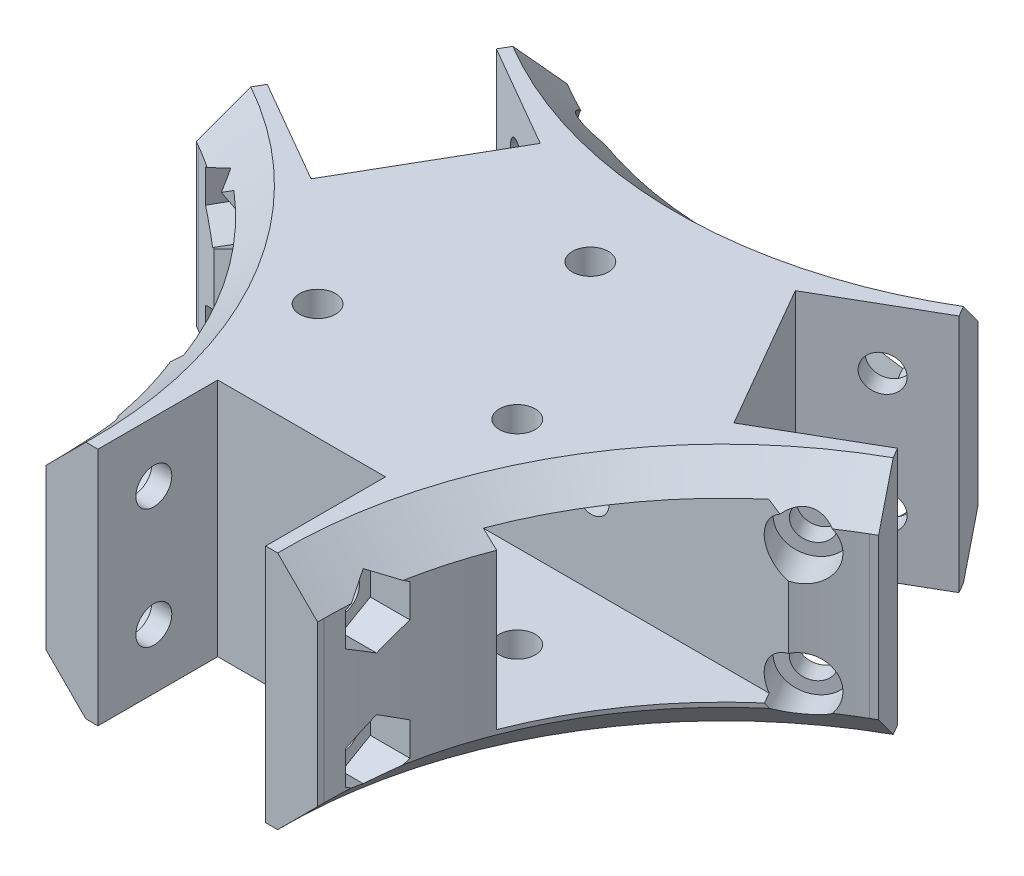
from build123d import *

# Parameters (mm, degrees)
BOSS_EXTRUDE1_DEPTH     = 30
FILLET1_R               = 50
SKETCH2_W               = 21
SKETCH2_H               = 21
CUT_EXTRUDE1_DEPTH      = 40
CHAMFER1_SIZE           = 5
CUT_EXTRUDE2_DEPTH      = 20
CUT_EXTRUDE2_DEPTH_BACK = 80
SKETCH3_R               = 2.25
SKETCH3_3_R             = 4
SKETCH3_3_R_2           = 2.25
CUT_EXTRUDE3_DEPTH      = 80
SKETCH4_R               = 2.25
CUT_EXTRUDE4_DEPTH      = 80
SKETCH5_R               = 3.75
CUT_EXTRUDE5_DEPTH      = 10
CUT_EXTRUDE6_DEPTH      = 10
CIRPATTERN1_COUNT       = 3
SKETCH7_R               = 2.25
CUT_EXTRUDE7_DEPTH      = 43
CUT_EXTRUDE8_DEPTH      = 43
CUT_EXTRUDE8_DEPTH_BACK = 43
SKETCH8_R               = 2.25
SKETCH8_6_R             = 2.25
CUT_EXTRUDE10_DEPTH     = 43


with BuildPart() as part:
    # Sketch1 → Boss-Extrude1 (new body)
    with BuildSketch(Plane(origin=(0, 608.934991197, 0), x_dir=(1, 0, 0), z_dir=(0, 1, 0))):
        Polygon((-26.467622393, 3.15673326), (-39.458003449, 10.65673326), (-42.708003449, 5.027568136), (-17, -9.814954576), (-17, -39.5), (-10.5, -39.5), (-10.5, -24.5), (10.5, -24.5), (10.5, -39.5), (17, -39.5), (17, -9.814954576), (42.708003449, 5.027568136), (39.458003449, 10.65673326), (26.467622393, 3.15673326), (15.967622393, 21.34326674), (28.958003449, 28.84326674), (25.708003449, 34.472431864), (0, 19.629909152), (-25.708003449, 34.472431864), (-28.958003449, 28.84326674), (-15.967622393, 21.34326674), align=None)
    extrude(amount=-BOSS_EXTRUDE1_DEPTH)

    # Fillet1
    fillet1_edges = [part.edges().sort_by_distance(p)[0] for p in [
        (17, 593.934991197, 9.814954576),
        (-17, 593.934991197, 9.814954576),
        (0, 593.934991197, -19.629909152),
    ]]
    fillet(fillet1_edges, radius=FILLET1_R)

    # Sketch2 → Cut-Extrude1 (cut, symmetric)
    with BuildSketch(Plane(origin=(0, 0, 0), x_dir=(0, 0, -1), z_dir=(1, 0, 0))):
        with Locations((-10, 595)):
            Rectangle(SKETCH2_W, SKETCH2_H)
    extrude(amount=CUT_EXTRUDE1_DEPTH, both=True, mode=Mode.SUBTRACT)

    # Chamfer1
    # the kernel refuses this chamfer: 5 mm, written as the material it takes off along each edge
    with BuildSketch(Plane(origin=(67, 608.934991197, 38.682468036), x_dir=(-0.9671024008469528, 0, 0.25438739409817457), z_dir=(0.25438739409817457, 0, 0.9671024008469528))) as chamfer1_piece_1:
        Polygon((50 + CHAMFER1_SIZE, 0), (50, CHAMFER1_SIZE), (50, 0), align=None)
    revolve(axis=Axis((67, 608.934991197, 38.682468036), (0, -1, 0)), revolution_arc=89.474576832, mode=Mode.SUBTRACT)
    with BuildSketch(Plane(origin=(-67, 608.934991197, 38.682468036), x_dir=(0.2632452547319335, 0, -0.9647289442434697), z_dir=(-0.9647289442434697, 0, -0.2632452547319335))) as chamfer1_piece_2:
        Polygon((50 + CHAMFER1_SIZE, 0), (50, CHAMFER1_SIZE), (50, 0), align=None)
    revolve(axis=Axis((-67, 608.934991197, 38.682468036), (0, -1, 0)), revolution_arc=89.474576832, mode=Mode.SUBTRACT)
    with BuildSketch(Plane(origin=(0, 608.934991197, -77.364936071), x_dir=(0.7038571461150196, 0, 0.7103415501452945), z_dir=(0.7103415501452945, 0, -0.7038571461150196))) as chamfer1_piece_3:
        Polygon((50 + CHAMFER1_SIZE, 0), (50, CHAMFER1_SIZE), (50, 0), align=None)
    revolve(axis=Axis((0, 608.934991197, -77.364936071), (0, -1, 0)), revolution_arc=89.474576832, mode=Mode.SUBTRACT)
    with BuildSketch(Plane(origin=(-67, 578.934991197, 38.682468036), x_dir=(0.2632452547319335, 0, -0.9647289442434697), z_dir=(-0.9647289442434697, 0, -0.2632452547319335))) as chamfer1_piece_4:
        Polygon((50, -CHAMFER1_SIZE), (50 + CHAMFER1_SIZE, 0), (50, 0), align=None)
    revolve(axis=Axis((-67, 578.934991197, 38.682468036), (0, -1, 0)), revolution_arc=89.474576832, mode=Mode.SUBTRACT)
    with BuildSketch(Plane(origin=(67, 578.934991197, 38.682468036), x_dir=(-0.9671024008469528, 0, 0.25438739409817457), z_dir=(0.25438739409817457, 0, 0.9671024008469528))) as chamfer1_piece_5:
        Polygon((50 + CHAMFER1_SIZE, 0), (50, -CHAMFER1_SIZE), (50, 0), align=None)
    revolve(axis=Axis((67, 578.934991197, 38.682468036), (0, -1, 0)), revolution_arc=89.474576832, mode=Mode.SUBTRACT)
    with BuildSketch(Plane(origin=(0, 578.934991197, -77.364936071), x_dir=(0.7038571461150196, 0, 0.7103415501452945), z_dir=(0.7103415501452945, 0, -0.7038571461150196))) as chamfer1_piece_6:
        Polygon((50 + CHAMFER1_SIZE, 0), (50, -CHAMFER1_SIZE), (50, 0), align=None)
    revolve(axis=Axis((0, 578.934991197, -77.364936071), (0, -1, 0)), revolution_arc=89.474576832, mode=Mode.SUBTRACT)

    # Sketch3 → Cut-Extrude2 (cut, two sides: drawn at the far end of the back side and taken through both)
    with BuildSketch(Plane.XY.offset(-10.5).offset(-CUT_EXTRUDE2_DEPTH_BACK)):
        with Locations(Location((-11.25, 595, 0), (0, 0, 180))):
            Circle(SKETCH3_R)
        with Locations(Location((11.25, 595, 0), (0, 0, 180))):
            Circle(SKETCH3_R)
    extrude(amount=CUT_EXTRUDE2_DEPTH + CUT_EXTRUDE2_DEPTH_BACK, mode=Mode.SUBTRACT)

    # Sketch3<3> → Cut-Extrude3 (cut)
    # profile 1 of 2: a face of its own
    with BuildSketch(Plane.XY.offset(-10.5)):
        with Locations((11.25, 595)):
            Circle(SKETCH3_3_R)
        with Locations(Location((11.25, 595, 0), (0, 0, 180))):
            Circle(SKETCH3_3_R_2, mode=Mode.SUBTRACT)
    # profile 2 of 2: a face of its own
    with BuildSketch(Plane.XY.offset(-10.5)):
        with Locations((-11.25, 595)):
            Circle(SKETCH3_3_R)
        with Locations(Location((-11.25, 595, 0), (0, 0, 180))):
            Circle(SKETCH3_3_R_2, mode=Mode.SUBTRACT)
    extrude(amount=-CUT_EXTRUDE3_DEPTH, mode=Mode.SUBTRACT)

    # Sketch4 → Cut-Extrude4 (cut, symmetric)
    with BuildSketch(Plane(origin=(0, 0, 0), x_dir=(0, 0, -1), z_dir=(1, 0, 0))):
        with Locations(Location((-32.5, 601.434991197, 0), (0, 0, 180))):
            Circle(SKETCH4_R)
        with Locations(Location((-32.5, 586.434991197, 0), (0, 0, 180))):
            Circle(SKETCH4_R)
    cut_extrude4 = extrude(amount=CUT_EXTRUDE4_DEPTH, both=True, mode=Mode.SUBTRACT)

    # Sketch5 → Cut-Extrude5 (cut)
    with BuildSketch(Plane(origin=(-13, 0, 0), x_dir=(0, 0, -1), z_dir=(1, 0, 0))):
        with Locations((-32.5, 601.434991197)):
            Circle(SKETCH5_R)
        with Locations((-32.5, 586.434991197)):
            Circle(SKETCH5_R)
    cut_extrude5 = extrude(amount=-CUT_EXTRUDE5_DEPTH, mode=Mode.SUBTRACT)

    # Sketch6 → Cut-Extrude6 (cut)
    with BuildSketch(Plane.ZY.offset(-13)):
        Polygon((32.5, 605.591913135), (28.9, 603.513452166), (28.9, 599.356530228), (32.5, 597.278069259), (36.1, 599.356530228), (36.1, 603.513452166), align=None)
        Polygon((32.5, 590.591913135), (28.9, 588.513452166), (28.9, 584.356530228), (32.5, 582.278069259), (36.1, 584.356530228), (36.1, 588.513452166), align=None)
    cut_extrude6 = extrude(amount=-CUT_EXTRUDE6_DEPTH, mode=Mode.SUBTRACT)

    # CirPattern1: Cut-Extrude4, Cut-Extrude5, Cut-Extrude6 ×3 about axis
    cirpattern1_axis = Axis((0, 0, 0), (0, 1, 0))
    add([cut_extrude4.rotate(cirpattern1_axis, i * 360 / CIRPATTERN1_COUNT) for i in range(1, CIRPATTERN1_COUNT)], mode=Mode.SUBTRACT)
    add([cut_extrude5.rotate(cirpattern1_axis, i * 360 / CIRPATTERN1_COUNT) for i in range(1, CIRPATTERN1_COUNT)], mode=Mode.SUBTRACT)
    add([cut_extrude6.rotate(cirpattern1_axis, i * 360 / CIRPATTERN1_COUNT) for i in range(1, CIRPATTERN1_COUNT)], mode=Mode.SUBTRACT)

    # Sketch7 → Cut-Extrude7 (cut)
    with BuildSketch(Plane.XZ.offset(-578.934991197)):
        with Locations(Location((-12.5, 10, 0), (0, 0, 90))):
            Circle(SKETCH7_R)
        with Locations(Location((12.5, 10, 0), (0, 0, 90))):
            Circle(SKETCH7_R)
    extrude(amount=-CUT_EXTRUDE7_DEPTH, mode=Mode.SUBTRACT)

    # Sketch8 → Cut-Extrude8 (cut, two sides: drawn at the far end of the back side and taken through both)
    with BuildSketch(Plane(origin=(0, 593.934991197, 0), x_dir=(-1, 0, 0), z_dir=(0, -1, 0)).offset(-CUT_EXTRUDE8_DEPTH_BACK)):
        with Locations(Location((0, 11.650635095, 0), (0, 0, 270))):
            Circle(SKETCH8_R)
    extrude(amount=CUT_EXTRUDE8_DEPTH + CUT_EXTRUDE8_DEPTH_BACK, mode=Mode.SUBTRACT)

    # Sketch8<6> → Cut-Extrude10 (cut)
    with BuildSketch(Plane(origin=(0, 593.934991197, 0), x_dir=(-1, 0, 0), z_dir=(0, -1, 0))):
        Polygon((2.078460969, 8.050635095), (4.156921938, 11.650635095), (2.078460969, 15.250635095), (-2.078460969, 15.250635095), (-4.156921938, 11.650635095), (-2.078460969, 8.050635095), align=None)
        with Locations(Location((0, 11.650635095, 0), (0, 0, 270))):
            Circle(SKETCH8_6_R, mode=Mode.SUBTRACT)
    extrude(amount=CUT_EXTRUDE10_DEPTH, mode=Mode.SUBTRACT)


solid = part.part
